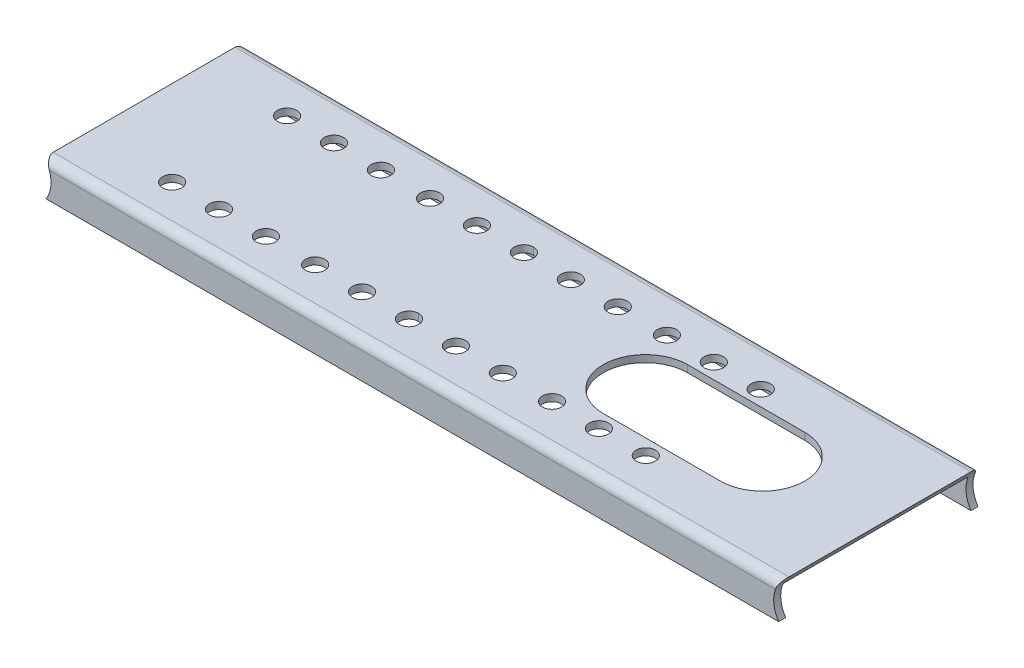
from build123d import *

# Parameters (mm, degrees)
SKETCH3_W                      = 333.036830712
SKETCH3_H                      = 85
BASE_FLANGE1_DEPTH             = 3
EDGE_FLANGE1_STRIP_W           = 13.4732
EDGE_FLANGE1_STRIP_H           = 3
EDGE_FLANGE1_STRIP_CUT_DEPTH   = 333.036830711
EDGE_FLANGE1_STRIP_2_W         = 13.4732
EDGE_FLANGE1_STRIP_2_H         = 3
EDGE_FLANGE1_STRIP_CUT_2_DEPTH = 333.036830711
EDGE_FLANGE1_DEPTH             = 333.036830711
EDGE_FLANGE1_BEND_DEPTH        = 333.036830711
SKETCH14_R                     = 4.1
CUT_EXTRUDE1_DEPTH             = 10
LPATTERN1_COUNT                = 3
LPATTERN1_PITCH                = 20
INDENT1_START                  = 23
INDENT1_DEPTH                  = 87
INDENT1_START_2                = 1066.181520764
INDENT1_2_DEPTH                = 11.708931468
INDENT1_START_3                = 23.50429019
INDENT1_3_DEPTH                = 85
INDENT1_START_4                = 1388.984464138
INDENT1_4_DEPTH                = 10.233887338
INDENT1_5_DEPTH                = 85
CUT_EXTRUDE2_DEPTH             = 10
LPATTERN2_COUNT                = 2
LPATTERN2_PITCH                = 101
LPATTERN2_COPY_1_SKETCH_R      = 4.1
LPATTERN2_COPY_1_DEPTH         = 10
LPATTERN2_COPY_2_SKETCH_R      = 4.1
LPATTERN2_COPY_2_DEPTH         = 10


with BuildPart() as part:
    # Base-Flange1: sheet metal written as solids
    # Sketch3 → Base-Flange1 (new body)
    with BuildSketch(Plane(origin=(-0.035963347, 187.801831242, 0), x_dir=(0.9999999816645936, 0.0001914962472965804, 0), z_dir=(-0.0001914962472965804, 0.9999999816645936, 0))):
        with Locations((1232.69993612, -66.00429019)):
            Rectangle(SKETCH3_W, SKETCH3_H)
    extrude(amount=-BASE_FLANGE1_DEPTH)

    # Edge-Flange1: sheet metal written as solids
    # Edge-Flange1 strip (on a plane across the edge) → Edge-Flange1 strip cut (cut)
    with BuildSketch(Plane(origin=(1399.182936963, 185.06977636, 108.50429019), x_dir=(0, 0, -1), z_dir=(-0.9999999816645935, -0.00019149624729661617, 0))):
        with Locations((-3, -1.5)):
            Rectangle(EDGE_FLANGE1_STRIP_W, EDGE_FLANGE1_STRIP_H)
    extrude(amount=EDGE_FLANGE1_STRIP_CUT_DEPTH, mode=Mode.SUBTRACT)

    # Edge-Flange1 strip 2 (on a plane across the edge) → Edge-Flange1 strip cut 2 (cut)
    with BuildSketch(Plane(origin=(1066.146112358, 185.006001057, 23.50429019), x_dir=(0, 0, 1), z_dir=(0.9999999816645935, 0.00019149624729661617, 0))):
        with Locations((-3, -1.5)):
            Rectangle(EDGE_FLANGE1_STRIP_2_W, EDGE_FLANGE1_STRIP_2_H)
    extrude(amount=EDGE_FLANGE1_STRIP_CUT_2_DEPTH, mode=Mode.SUBTRACT)

    # Edge-Flange1 section (on a plane across the edge) → Edge-Flange1 (add)
    with BuildSketch(Plane(origin=(1399.182936963, 185.06977636, 108.50429019), x_dir=(0, 0, -1), z_dir=(-0.9999999816645935, -0.00019149624729661617, 0))):
        with BuildLine():
            Line((0, 0.7366), (0, 12))
            Line((0, 12), (3, 12))
            Line((3, 12), (3, 0.7366))
            ThreePointArc((3, 0.7366), (3.215745145, 0.215745145), (3.7366, 0))
            Line((3.7366, 0), (3.7366, -3))
            ThreePointArc((3.7366, -3), (1.094424801, -1.905575199), (0, 0.7366))
        make_face()
    extrude(amount=EDGE_FLANGE1_DEPTH)

    # Edge-Flange1 section 2 (on a plane across the edge) → Edge-Flange1 bend (add)
    with BuildSketch(Plane(origin=(1066.146112358, 185.006001057, 23.50429019), x_dir=(0, 0, 1), z_dir=(0.9999999816645935, 0.00019149624729661617, 0))):
        with BuildLine():
            Line((0, 0.7366), (0, 12))
            Line((0, 12), (3, 12))
            Line((3, 12), (3, 0.7366))
            ThreePointArc((3, 0.7366), (3.215745145, 0.215745145), (3.7366, 0))
            Line((3.7366, 0), (3.7366, -3))
            ThreePointArc((3.7366, -3), (1.094424801, -1.905575199), (0, 0.7366))
        make_face()
    extrude(amount=EDGE_FLANGE1_BEND_DEPTH)

    # Sketch14 → Cut-Extrude1 (cut)
    with BuildSketch(Plane(origin=(-0.035963347, 187.801831242, 0), x_dir=(0.9999999816645936, 0.00019149624729658044, 0), z_dir=(-0.00019149624729658044, 0.9999999816645936, 0))):
        with Locations(Location((1152.844912527, -41.50429019, 0), (0, 0, 180))):
            Circle(SKETCH14_R)
        with Locations(Location((1213.814912527, -41.50429019, 0), (0, 0, 180))):
            Circle(SKETCH14_R)
        with Locations(Location((1152.844912527, -90.50429019, 0), (0, 0, 180))):
            Circle(SKETCH14_R)
        with Locations(Location((1213.814912527, -90.50429019, 0), (0, 0, 180))):
            Circle(SKETCH14_R)
    cut_extrude1 = extrude(amount=-CUT_EXTRUDE1_DEPTH, mode=Mode.SUBTRACT)

    # LPattern1: Cut-Extrude1 ×3
    with Locations(*[Vector(-0.9999999816645936, -0.00019149624729658041, 0) * (i * LPATTERN1_PITCH) for i in range(1, LPATTERN1_COUNT)]):
        add(cut_extrude1, mode=Mode.SUBTRACT)

    # Indent1: read off the stored shape, not the designer's step
    # Indent1 outline → Indent1 (cut)
    with BuildSketch(Plane.XY.offset(INDENT1_START)):
        with BuildLine():
            Line((1391.658769663, 190), (1390.104573792, 188.068047026))
            ThreePointArc((1390.104573792, 188.068047026), (1387.312839815, 180.67842019), (1389.429552771, 173.067908404))
            Line((1389.429552771, 173.067908404), (1390.14074534, 172))
            Line((1390.14074534, 172), (1399.185439777, 172))
            Line((1399.185439777, 172), (1401, 172))
            Line((1401, 172), (1401, 190))
            Line((1401, 190), (1391.658769663, 190))
        make_face()
        with BuildLine():
            Line((1076.353702039, 188.007964899), (1074.752112936, 190))
            Line((1074.752112936, 190), (1065, 190))
            Line((1065, 190), (1065, 172))
            Line((1065, 172), (1066.14860296, 172))
            Line((1066.14860296, 172), (1076.353013915, 172))
            Line((1076.353013915, 172), (1077.024720786, 173.00808405))
            ThreePointArc((1077.024720786, 173.00808405), (1079.143304168, 180.617808163), (1076.353702039, 188.007964899))
        make_face()
    extrude(amount=INDENT1_DEPTH, mode=Mode.SUBTRACT)

    # Sketch15 → Cut-Extrude2 (cut)
    with BuildSketch(Plane(origin=(-0.035963347, 187.801831242, 0), x_dir=(0.9999999816645936, 0.0001914962472966162, 0), z_dir=(-0.0001914962472966162, 0.9999999816645936, 0))):
        with BuildLine():
            Line((1290.140555319, -48.00429019), (1340.140555319, -48.00429019))
            ThreePointArc((1340.140555319, -48.00429019), (1358.140555319, -66.00429019), (1340.140555319, -84.00429019))
            Line((1340.140555319, -84.00429019), (1290.140555319, -84.00429019))
            ThreePointArc((1290.140555319, -84.00429019), (1272.140555319, -66.00429019), (1290.140555319, -48.00429019))
        make_face()
    extrude(amount=-CUT_EXTRUDE2_DEPTH, mode=Mode.SUBTRACT)

    # LPattern2: Cut-Extrude1 ×2
    with Locations(*[Vector(0.9999999816645935, 0.0001914962472965804, 0) * (i * LPATTERN2_PITCH) for i in range(1, LPATTERN2_COUNT)]):
        add(cut_extrude1, mode=Mode.SUBTRACT)

    # LPattern2 copy 1 sketch → LPattern2 copy 1 (cut)
    with BuildSketch(Plane(origin=(80.964035168, 187.817342438, 0), x_dir=(0.9999999816645936, 0.00019149624729658044, 0), z_dir=(-0.00019149624729658044, 0.9999999816645936, 0))):
        with Locations(Location((1152.844912527, -41.50429019, 0), (0, 0, 180))):
            Circle(LPATTERN2_COPY_1_SKETCH_R)
        with Locations(Location((1213.814912527, -41.50429019, 0), (0, 0, 180))):
            Circle(LPATTERN2_COPY_1_SKETCH_R)
        with Locations(Location((1152.844912527, -90.50429019, 0), (0, 0, 180))):
            Circle(LPATTERN2_COPY_1_SKETCH_R)
        with Locations(Location((1213.814912527, -90.50429019, 0), (0, 0, 180))):
            Circle(LPATTERN2_COPY_1_SKETCH_R)
    extrude(amount=-LPATTERN2_COPY_1_DEPTH, mode=Mode.SUBTRACT)

    # LPattern2 copy 2 sketch → LPattern2 copy 2 (cut)
    with BuildSketch(Plane(origin=(60.964035535, 187.813512513, 0), x_dir=(0.9999999816645936, 0.00019149624729658044, 0), z_dir=(-0.00019149624729658044, 0.9999999816645936, 0))):
        with Locations(Location((1152.844912527, -41.50429019, 0), (0, 0, 180))):
            Circle(LPATTERN2_COPY_2_SKETCH_R)
        with Locations(Location((1213.814912527, -41.50429019, 0), (0, 0, 180))):
            Circle(LPATTERN2_COPY_2_SKETCH_R)
        with Locations(Location((1152.844912527, -90.50429019, 0), (0, 0, 180))):
            Circle(LPATTERN2_COPY_2_SKETCH_R)
        with Locations(Location((1213.814912527, -90.50429019, 0), (0, 0, 180))):
            Circle(LPATTERN2_COPY_2_SKETCH_R)
    extrude(amount=-LPATTERN2_COPY_2_DEPTH, mode=Mode.SUBTRACT)


with BuildPart() as body_2:
    # Indent1 2 outline → Indent1 2 (new body)
    with BuildSketch(Plane(origin=(0, 0, 0), x_dir=(-0.00019149624731436396, 0.9999999816645935, 0), z_dir=(0.9999999816645936, 0.00019149624731436393, 0)).offset(INDENT1_START_2)):
        with BuildLine():
            ThreePointArc((184.801834685, 27.24089019), (184.58608954, 26.720035335), (184.065234685, 26.50429019))
            Line((184.065234685, 26.50429019), (172.801834685, 26.50429019))
            Line((172.801834685, 26.50429019), (172.801834685, 23.50429019))
            Line((172.801834685, 23.50429019), (184.065234685, 23.50429019))
            ThreePointArc((184.065234685, 23.50429019), (186.707409883, 24.598714992), (187.801834685, 27.24089019))
            Line((187.801834685, 27.24089019), (187.801834685, 104.76769019))
            ThreePointArc((187.801834685, 104.76769019), (186.707409884, 107.409865389), (184.065234685, 108.50429019))
            Line((184.065234685, 108.50429019), (172.801834685, 108.50429019))
            Line((172.801834685, 108.50429019), (172.801834685, 105.50429019))
            Line((172.801834685, 105.50429019), (184.065234685, 105.50429019))
            ThreePointArc((184.065234685, 105.50429019), (184.58608954, 105.288545045), (184.801834685, 104.76769019))
            Line((184.801834685, 104.76769019), (184.801834685, 27.24089019))
        make_face()
    extrude(amount=INDENT1_2_DEPTH)

    # Indent1 3 outline → Indent1 3 (cut)
    with BuildSketch(Plane.XY.offset(INDENT1_START_3)):
        with BuildLine():
            Line((1077.855992631, 180.052424815), (1077.854469122, 188.008243218))
            Line((1077.854469122, 188.008243218), (1074.619319449, 188.007634777))
            ThreePointArc((1074.619319449, 188.007634777), (1077.015456668, 184.346487369), (1077.855992631, 180.052424815))
        make_face()
        with BuildLine():
            ThreePointArc((1077.855992631, 180.052424815), (1077.230304306, 176.325431683), (1075.420572237, 173.007776861))
            Line((1075.420572237, 173.007776861), (1077.857341566, 173.008243493))
            Line((1077.857341566, 173.008243493), (1077.855992631, 180.052424815))
        make_face()
    extrude(amount=INDENT1_3_DEPTH, mode=Mode.SUBTRACT)


with BuildPart() as body_3:
    # Indent1 4 outline → Indent1 4 (new body)
    with BuildSketch(Plane(origin=(0, 0, 0), x_dir=(-0.00019149624729552394, 0.9999999816645935, 0), z_dir=(0.9999999816645936, 0.0001914962472955239, 0)).offset(INDENT1_START_4)):
        with BuildLine():
            ThreePointArc((187.801834685, 104.76769019), (186.707409884, 107.409865389), (184.065234685, 108.50429019))
            Line((184.065234685, 108.50429019), (172.801834685, 108.50429019))
            Line((172.801834685, 108.50429019), (172.801834685, 105.50429019))
            Line((172.801834685, 105.50429019), (184.065234685, 105.50429019))
            ThreePointArc((184.065234685, 105.50429019), (184.58608954, 105.288545045), (184.801834685, 104.76769019))
            Line((184.801834685, 104.76769019), (184.801834685, 27.24089019))
            ThreePointArc((184.801834685, 27.24089019), (184.58608954, 26.720035335), (184.065234685, 26.50429019))
            Line((184.065234685, 26.50429019), (172.801834685, 26.50429019))
            Line((172.801834685, 26.50429019), (172.801834685, 23.50429019))
            Line((172.801834685, 23.50429019), (184.065234685, 23.50429019))
            ThreePointArc((184.065234685, 23.50429019), (186.707409883, 24.598714992), (187.801834685, 27.24089019))
            Line((187.801834685, 27.24089019), (187.801834685, 104.76769019))
        make_face()
    extrude(amount=INDENT1_4_DEPTH)

    # Indent1 5 outline → Indent1 5 (cut)
    with BuildSketch(Plane.XY.offset(INDENT1_START_3)):
        with BuildLine():
            ThreePointArc((1391.482231002, 173.068301484), (1389.602669792, 176.366092083), (1388.950000203, 180.105369497))
            Line((1388.950000203, 180.105369497), (1388.951347768, 173.067816829))
            Line((1388.951347768, 173.067816829), (1391.482231002, 173.068301484))
        make_face()
        with BuildLine():
            Line((1392.336768964, 188.068477256), (1388.948475324, 188.067816554))
            Line((1388.948475324, 188.067816554), (1388.950000203, 180.105369497))
            ThreePointArc((1388.950000203, 180.105369497), (1389.831468968, 184.432237107), (1392.336768964, 188.068477256))
        make_face()
    extrude(amount=INDENT1_5_DEPTH, mode=Mode.SUBTRACT)


solid = part.part
